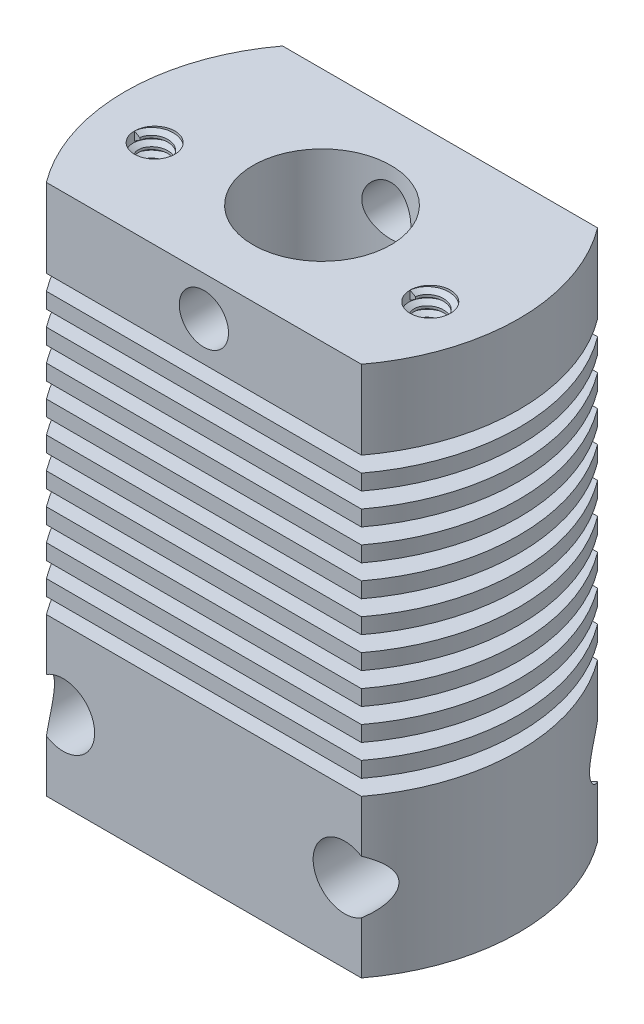
from build123d import *
from build123d.topology import SkipClean

# Parameters (mm, degrees)
CROQUIS1_W                   = 20
CROQUIS1_H                   = 12
CROQUIS1_R                   = 3.5
SALIENTE_EXTRUIR1_DEPTH      = 27
CROQUIS3_R                   = 20
CROQUIS3_R_2                 = 10
CORTAR_EXTRUIR_L_MINA1_DEPTH = 27
CROQUIS5_W                   = 5.7
CROQUIS5_H                   = 0.7894
CORTAR_EXTRUIR2_DEPTH        = 27
CROQUIS4_R                   = 1.6
CROQUIS4_R_2                 = 1.25
CORTAR_EXTRUIR1_DEPTH        = 27
CROQUIS8_R                   = 1.025
CORTAR_EXTRUIR3_DEPTH        = 5
ROSCA2_PITCH                 = 0.5
ROSCA3_PITCH                 = 0.5
CROQUIS9_R                   = 14.4
CROQUIS9_R_2                 = 4.4
CORTAR_EXTRUIR_L_MINA2_DEPTH = 0.7894
CROQUIS10_W                  = 5.7
CROQUIS10_H                  = 0.7894


with BuildPart() as part:
    # Croquis1 → Saliente-Extruir1 (new body)
    with BuildSketch(Plane(origin=(0, 0, 0), x_dir=(1, 0, 0), z_dir=(0, 1, 0))):
        Rectangle(CROQUIS1_W, CROQUIS1_H)
        with Locations(Location((0, 0, 0), (0, 0, 270))):
            Circle(CROQUIS1_R, mode=Mode.SUBTRACT)
    extrude(amount=SALIENTE_EXTRUIR1_DEPTH)

    # Croquis3 → Cortar-Extruir-Lámina1 (cut)
    with BuildSketch(Plane(origin=(0, 27, 0), x_dir=(1, 0, 0), z_dir=(0, 1, 0))):
        Circle(CROQUIS3_R)
        Circle(CROQUIS3_R_2, mode=Mode.SUBTRACT)
    extrude(amount=-CORTAR_EXTRUIR_L_MINA1_DEPTH, mode=Mode.SUBTRACT)

    # Croquis5 → Cortar-Extruir2 (cut)
    with BuildSketch(Plane.XY.offset(6)):
        with Locations((-7.15, 22.6053)):
            Rectangle(CROQUIS5_W, CROQUIS5_H)
        with Locations((7.15, 22.6053)):
            Rectangle(CROQUIS5_W, CROQUIS5_H)
        with Locations((7.15, 21.0253)):
            Rectangle(CROQUIS5_W, CROQUIS5_H)
        with Locations((7.15, 19.4453)):
            Rectangle(CROQUIS5_W, CROQUIS5_H)
        with Locations((7.15, 17.8653)):
            Rectangle(CROQUIS5_W, CROQUIS5_H)
        with Locations((7.15, 16.2853)):
            Rectangle(CROQUIS5_W, CROQUIS5_H)
        with Locations((7.15, 14.7053)):
            Rectangle(CROQUIS5_W, CROQUIS5_H)
        with Locations((7.15, 13.1253)):
            Rectangle(CROQUIS5_W, CROQUIS5_H)
        with Locations((7.15, 11.5453)):
            Rectangle(CROQUIS5_W, CROQUIS5_H)
        with Locations((7.15, 9.9653)):
            Rectangle(CROQUIS5_W, CROQUIS5_H)
        with Locations((7.15, 8.3853)):
            Rectangle(CROQUIS5_W, CROQUIS5_H)
        with Locations((-7.15, 21.0253)):
            Rectangle(CROQUIS5_W, CROQUIS5_H)
        with Locations((-7.15, 19.4453)):
            Rectangle(CROQUIS5_W, CROQUIS5_H)
        with Locations((-7.15, 17.8653)):
            Rectangle(CROQUIS5_W, CROQUIS5_H)
        with Locations((-7.15, 16.2853)):
            Rectangle(CROQUIS5_W, CROQUIS5_H)
        with Locations((-7.15, 14.7053)):
            Rectangle(CROQUIS5_W, CROQUIS5_H)
        with Locations((-7.15, 13.1253)):
            Rectangle(CROQUIS5_W, CROQUIS5_H)
        with Locations((-7.15, 11.5453)):
            Rectangle(CROQUIS5_W, CROQUIS5_H)
        with Locations((-7.15, 9.9653)):
            Rectangle(CROQUIS5_W, CROQUIS5_H)
        with Locations((-7.15, 8.3853)):
            Rectangle(CROQUIS5_W, CROQUIS5_H)
    extrude(amount=-CORTAR_EXTRUIR2_DEPTH, mode=Mode.SUBTRACT)

    # Croquis4 → Cortar-Extruir1 (cut)
    with BuildSketch(Plane.XY.offset(6)):
        with Locations(Location((-7.15, 4, 0), (0, 0, 237.910048744))):
            Circle(CROQUIS4_R)
        with Locations(Location((7.15, 4, 0), (0, 0, 57.910048744))):
            Circle(CROQUIS4_R)
        with Locations((0, 25)):
            Circle(CROQUIS4_R_2)
    extrude(amount=-CORTAR_EXTRUIR1_DEPTH, mode=Mode.SUBTRACT)

    # Croquis8 → Cortar-Extruir3 (cut)
    with BuildSketch(Plane(origin=(0, 27, 0), x_dir=(1, 0, 0), z_dir=(0, 1, 0))):
        with Locations(Location((-7, -1.5, 0), (0, 0, 270))):
            Circle(CROQUIS8_R)
        with Locations(Location((7, -1.5, 0), (0, 0, 270))):
            Circle(CROQUIS8_R)
    extrude(amount=-CORTAR_EXTRUIR3_DEPTH, mode=Mode.SUBTRACT)

    # Rosca2: arcs per turn and ends read off the stored shape
    # Rosca2: the profile of Perfil de rosca2 profile screwed along a right-hand helix through 7 turns, 6 arcs to a turn; built about Z, then put on its axis
    with SkipClean():  # the faces are left unmerged after this step: merging them gives an invalid solid
        rosca2_z = Axis((0, 0, 0), (0, 0, 1))
        rosca2_corners = [(1.0253, 0, -0.000173205), (1.0253, 0, 0.437673204), (0.754367063, 0, 0.281249999), (0.754367063, 0, 0.156249999)]
        with BuildLine(mode=Mode.PRIVATE) as rosca2_profile:
            Line(rosca2_corners[0], rosca2_corners[1])
            Line(rosca2_corners[1], rosca2_corners[2])
            Line(rosca2_corners[2], rosca2_corners[3])
            Line(rosca2_corners[3], rosca2_corners[0])
        rosca2_cap = Face(rosca2_profile.wire())
        rosca2_turn_angles = [0, 30, 60, 90, 120, 150, 180, 210, 240, 270, 300, 330, 360]
        rosca2_turn_weights = [1, 0.8660254037844387, 1, 0.8660254037844387, 1, 0.8660254037844387, 1, 0.8660254037844387, 1, 0.8660254037844387, 1, 0.8660254037844387, 1]
        rosca2_turn_rails = [Edge.make_bspline([Vector(p[0], p[1], 0).rotate(rosca2_z, rosca2_turn_angles[k]) / rosca2_turn_weights[k] + Vector(0, 0, p[2] + ROSCA2_PITCH * rosca2_turn_angles[k] / 360) for k in range(13)], [0, 0, 0, 1, 1, 2, 2, 3, 3, 4, 4, 5, 5, 6, 6, 6], 2, rosca2_turn_weights) for p in rosca2_corners]
        rosca2_turn_sides = [Face.make_surface_from_curves(rosca2_turn_rails[p[0]], rosca2_turn_rails[p[1]]) for p in [(0, 1), (1, 2), (2, 3), (3, 0)]]
        rosca2 = Plane(origin=(-7, 27, 1.5), x_dir=(-1, 0, 0), z_dir=(0, -1, 0)) * Solid(Shell([*[p.moved(Location((0, 0, ROSCA2_PITCH * i))) for i in range(7) for p in rosca2_turn_sides], rosca2_cap, rosca2_cap.rotate(rosca2_z, 2520).moved(Location((0, 0, ROSCA2_PITCH * 2520 / 360)))]))
        add(rosca2)

    # Rosca3: arcs per turn and ends read off the stored shape
    # Rosca3: the profile of Perfil de rosca3 profile screwed along a right-hand helix through 7 turns, 6 arcs to a turn; built about Z, then put on its axis
    with SkipClean():  # the faces are left unmerged after this step: merging them gives an invalid solid
        rosca3_z = Axis((0, 0, 0), (0, 0, 1))
        rosca3_corners = [(1.0253, 0, -0.000173205), (1.0253, 0, 0.437673204), (0.754367063, 0, 0.281249999), (0.754367063, 0, 0.156249999)]
        with BuildLine(mode=Mode.PRIVATE) as rosca3_profile:
            Line(rosca3_corners[0], rosca3_corners[1])
            Line(rosca3_corners[1], rosca3_corners[2])
            Line(rosca3_corners[2], rosca3_corners[3])
            Line(rosca3_corners[3], rosca3_corners[0])
        rosca3_cap = Face(rosca3_profile.wire())
        rosca3_turn_angles = [0, 30, 60, 90, 120, 150, 180, 210, 240, 270, 300, 330, 360]
        rosca3_turn_weights = [1, 0.8660254037844387, 1, 0.8660254037844387, 1, 0.8660254037844387, 1, 0.8660254037844387, 1, 0.8660254037844387, 1, 0.8660254037844387, 1]
        rosca3_turn_rails = [Edge.make_bspline([Vector(p[0], p[1], 0).rotate(rosca3_z, rosca3_turn_angles[k]) / rosca3_turn_weights[k] + Vector(0, 0, p[2] + ROSCA3_PITCH * rosca3_turn_angles[k] / 360) for k in range(13)], [0, 0, 0, 1, 1, 2, 2, 3, 3, 4, 4, 5, 5, 6, 6, 6], 2, rosca3_turn_weights) for p in rosca3_corners]
        rosca3_turn_sides = [Face.make_surface_from_curves(rosca3_turn_rails[p[0]], rosca3_turn_rails[p[1]]) for p in [(0, 1), (1, 2), (2, 3), (3, 0)]]
        rosca3 = Plane(origin=(7, 27, 1.5), x_dir=(-1, 0, 0), z_dir=(0, -1, 0)) * Solid(Shell([*[p.moved(Location((0, 0, ROSCA3_PITCH * i))) for i in range(7) for p in rosca3_turn_sides], rosca3_cap, rosca3_cap.rotate(rosca3_z, 2520).moved(Location((0, 0, ROSCA3_PITCH * 2520 / 360)))]))
        add(rosca3)

    # Croquis9 → Cortar-Extruir-Lámina2 (cut)
    with SkipClean():  # the faces are left unmerged after this step: merging them gives an invalid solid
        with BuildSketch(Plane.XZ.offset(-23)):
            Circle(CROQUIS9_R)
            Circle(CROQUIS9_R_2, mode=Mode.SUBTRACT)
        extrude(amount=CORTAR_EXTRUIR_L_MINA2_DEPTH, mode=Mode.SUBTRACT)

    # Croquis10 → Cortar-Revolución1 (revolve, cut)
    with SkipClean():  # the faces are left unmerged after this step: merging them gives an invalid solid
        with BuildSketch(Plane.XY, mode=Mode.PRIVATE) as cortar_revoluci_n1_sk:
            with Locations((7.15, 22.6053)):
                Rectangle(CROQUIS10_W, CROQUIS10_H)
            with Locations((7.15, 21.0253)):
                Rectangle(CROQUIS10_W, CROQUIS10_H)
            with Locations((7.15, 19.4453)):
                Rectangle(CROQUIS10_W, CROQUIS10_H)
            with Locations((7.15, 17.8653)):
                Rectangle(CROQUIS10_W, CROQUIS10_H)
            with Locations((7.15, 16.2853)):
                Rectangle(CROQUIS10_W, CROQUIS10_H)
            with Locations((7.15, 14.7053)):
                Rectangle(CROQUIS10_W, CROQUIS10_H)
            with Locations((7.15, 13.1253)):
                Rectangle(CROQUIS10_W, CROQUIS10_H)
            with Locations((7.15, 11.5453)):
                Rectangle(CROQUIS10_W, CROQUIS10_H)
            with Locations((7.15, 9.9653)):
                Rectangle(CROQUIS10_W, CROQUIS10_H)
            with Locations((7.15, 8.3853)):
                Rectangle(CROQUIS10_W, CROQUIS10_H)
        revolve(cortar_revoluci_n1_sk.sketch.rotate(Axis((0, 0, 0), (0, 1, 0)), 90), axis=Axis((0, 0, 0), (0, 1, 0)), mode=Mode.SUBTRACT)


solid = part.part
